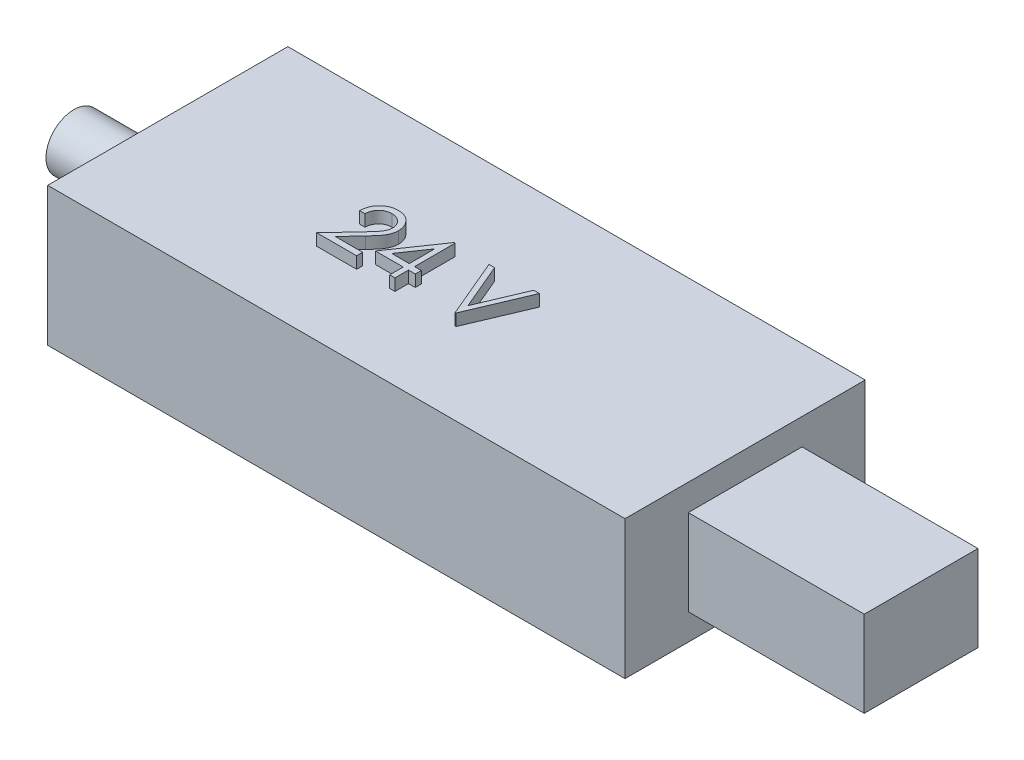
from build123d import *

# Parameters (mm, degrees)
SKETCH1_W           = 125
SKETCH1_H           = 52
BOSS_EXTRUDE1_DEPTH = 30
SKETCH2_W           = 24.62687601
SKETCH2_H           = 18.598470566
BOSS_EXTRUDE2_DEPTH = 38.1
SKETCH3_R           = 6.039414619
BOSS_EXTRUDE3_DEPTH = 20.32
BOSS_EXTRUDE4_DEPTH = 2.54


with BuildPart() as part:
    # Sketch1 → Boss-Extrude1 (new body)
    with BuildSketch(Plane(origin=(0, 0, 0), x_dir=(1, 0, 0), z_dir=(0, 1, 0))):
        Rectangle(SKETCH1_W, SKETCH1_H)
    extrude(amount=BOSS_EXTRUDE1_DEPTH)

    # Sketch2 → Boss-Extrude2 (add)
    with BuildSketch(Plane(origin=(62.5, 0, 0), x_dir=(0, 0, -1), z_dir=(1, 0, 0))):
        with Locations((0, 15)):
            Rectangle(SKETCH2_W, SKETCH2_H)
    extrude(amount=BOSS_EXTRUDE2_DEPTH)

    # Sketch3 → Boss-Extrude3 (add)
    with BuildSketch(Plane.ZY.offset(62.5)):
        with Locations((0, 15)):
            Circle(SKETCH3_R)
    extrude(amount=BOSS_EXTRUDE3_DEPTH)

    # Sketch4 → Boss-Extrude4 (add)
    # profile 1 of 3: a face of its own
    with BuildSketch(Plane(origin=(0, 30, 0), x_dir=(1, 0, 0), z_dir=(0, 1, 0))):
        with BuildLine():
            Line((-20.314153968, 0.487864775), (-21.453897558, 0.487864775))
            add(Edge.make_bspline(
                [(-21.453897558, 0.487864775), (-21.446469317, 0.639070568), (-21.431880449, 0.936034721), (-21.363560657, 1.369010039), (-21.26580376, 1.782866023), (-21.127586198, 2.17427971), (-20.95593199, 2.546711954), (-20.750083034, 2.898683439), (-20.506265347, 3.228851467), (-20.22974377, 3.53415527), (-19.929411851, 3.814235884), (-19.60535887, 4.056099193), (-19.264835486, 4.260451887), (-18.908874809, 4.431289536), (-18.533460764, 4.559522691), (-18.142000109, 4.654669783), (-17.732772957, 4.71191538), (-17.453953448, 4.71806866), (-17.312150763, 4.721198109)],
                knots=[0, 0, 0, 0, 1.10065271, 2.161652631, 3.183658789, 4.190468796, 5.17591951, 6.163126047, 7.15150782, 8.156236427, 9.156009102, 10.134482811, 11.092018607, 12.041330605, 13.001268258, 13.972401359, 14.968799086, 16, 16, 16, 16], degree=3))
            add(Edge.make_bspline(
                [(-17.312150763, 4.721198109), (-17.17289318, 4.717937995), (-16.899257003, 4.711531989), (-16.499889122, 4.656519111), (-16.119697225, 4.570356536), (-15.759424473, 4.449469168), (-15.421945324, 4.286965675), (-15.104724562, 4.091757463), (-14.80398562, 3.865988361), (-14.533269577, 3.600181666), (-14.284683118, 3.316418728), (-14.070226364, 3.013476906), (-13.886572885, 2.700587784), (-13.733491875, 2.375365452), (-13.620802456, 2.034747721), (-13.535247244, 1.683693585), (-13.486887772, 1.318569271), (-13.479465807, 1.071439769), (-13.47569243, 0.945797468)],
                knots=[0, 0, 0, 0, 1.111607364, 2.184268762, 3.212621178, 4.221274766, 5.211760367, 6.196651075, 7.1921475, 8.207485113, 9.220403448, 10.201281604, 11.166441695, 12.114753415, 13.065576456, 14.026450734, 14.996634279, 16, 16, 16, 16], degree=3))
            add(Edge.make_bspline(
                [(-13.47569243, 0.945797468), (-13.481836555, 0.768912468), (-13.494016985, 0.41824655), (-13.598209151, -0.097064524), (-13.76093792, -0.596332073), (-13.956871186, -0.998150283), (-14.15452834, -1.321940389), (-14.332645868, -1.588526833), (-14.541161039, -1.875566675), (-14.783108732, -2.182098728), (-15.053484011, -2.510524012), (-15.354735861, -2.860644127), (-15.689012495, -3.228841692), (-15.923630484, -3.480322017), (-16.045203648, -3.610632821)],
                knots=[0, 0, 0, 0, 1.184426356, 2.348067706, 3.509069118, 4.696110526, 5.333549288, 6.050745305, 6.844228056, 7.710549037, 8.667450064, 9.695053472, 10.805634456, 12, 12, 12, 12], degree=3))
            Line((-16.045203648, -3.610632821), (-19.222747718, -7.001878814))
            Line((-19.222747718, -7.001878814), (-13.312871917, -7.001878814))
            Line((-13.312871917, -7.001878814), (-13.312871917, -8.304442917))
            Line((-13.312871917, -8.304442917), (-21.942359096, -8.304442917))
            Line((-21.942359096, -8.304442917), (-17.017038583, -3.048393237))
            add(Edge.make_bspline(
                [(-17.017038583, -3.048393237), (-16.897121966, -2.923213668), (-16.666786684, -2.682769334), (-16.341004191, -2.331730593), (-16.048399862, -2.006067973), (-15.787079609, -1.706396783), (-15.562712318, -1.428333666), (-15.363604505, -1.180884313), (-15.204072217, -0.953175307), (-15.030933496, -0.689230794), (-14.863242763, -0.366968957), (-14.719143643, 0.026853286), (-14.631278336, 0.432263603), (-14.620737932, 0.706228138), (-14.615436019, 0.844034647)],
                knots=[0, 0, 0, 0, 1.329631726, 2.553950428, 3.673215718, 4.687767853, 5.603093632, 6.413772471, 7.123043292, 7.734684054, 8.834405432, 9.900288307, 10.943827018, 12, 12, 12, 12], degree=3))
            add(Edge.make_bspline(
                [(-14.615436019, 0.844034647), (-14.617742856, 0.930690007), (-14.622289187, 1.101471081), (-14.662412832, 1.351863407), (-14.723048097, 1.593398589), (-14.809935176, 1.826819578), (-14.92462249, 2.049779515), (-15.064225898, 2.262549801), (-15.225298413, 2.46824976), (-15.411630162, 2.661120299), (-15.616323391, 2.83776353), (-15.832565383, 2.994242354), (-16.061347189, 3.125012842), (-16.301704204, 3.232213532), (-16.552966336, 3.316307058), (-16.815619554, 3.37457676), (-17.088938127, 3.411161774), (-17.27556824, 3.416111769), (-17.370664385, 3.418634006)],
                knots=[0, 0, 0, 0, 0.991446411, 1.95395049, 2.89581595, 3.838931463, 4.798493298, 5.75982156, 6.748411868, 7.785213223, 8.824556874, 9.840280684, 10.836137867, 11.835679398, 12.848801643, 13.863922112, 14.911575587, 16, 16, 16, 16], degree=3))
            add(Edge.make_bspline(
                [(-17.370664385, 3.418634006), (-17.469981406, 3.416039461), (-17.665023638, 3.410944201), (-17.951386986, 3.375301963), (-18.224566808, 3.313812771), (-18.485250284, 3.229714553), (-18.733878496, 3.122822104), (-18.969242313, 2.989683488), (-19.190813368, 2.830811955), (-19.399008181, 2.650687651), (-19.590828905, 2.450145212), (-19.759364712, 2.226589061), (-19.906626706, 1.984101011), (-20.035111639, 1.723335356), (-20.139453714, 1.441925925), (-20.21918486, 1.140871682), (-20.282274275, 0.821479812), (-20.303350907, 0.60091679), (-20.314153968, 0.487864775)],
                knots=[0, 0, 0, 0, 1.031018746, 2.02475058, 2.990194455, 3.934040569, 4.864654155, 5.795059489, 6.735614925, 7.690564532, 8.649604399, 9.611025574, 10.590972636, 11.591080095, 12.624614302, 13.701020113, 14.821632451, 16, 16, 16, 16], degree=3))
        make_face()
    # profile 2 of 3: a face of its own
    with BuildSketch(Plane(origin=(0, 30, 0), x_dir=(1, 0, 0), z_dir=(0, 1, 0))):
        Polygon((-5.24053618, 4.721198109), (-5.009025763, 4.721198109), (-5.009025763, -4.071109584), (-3.543641148, -4.071109584), (-3.543641148, -5.373673686), (-5.009025763, -5.373673686), (-5.009025763, -8.304442917), (-6.148769353, -8.304442917), (-6.148769353, -5.373673686), (-12.173128327, -5.373673686), align=None)
        Polygon((-6.148769353, -4.071109584), (-6.148769353, 1.444435288), (-9.934346276, -4.071109584), align=None, mode=Mode.SUBTRACT)
    # profile 3 of 3: a face of its own
    with BuildSketch(Plane(origin=(0, 30, 0), x_dir=(1, 0, 0), z_dir=(0, 1, 0))):
        Polygon((2.64353834, 4.395557083), (3.864692186, 4.395557083), (8.098025519, -5.612816314), (12.331358852, 4.395557083), (13.552512699, 4.395557083), (8.179435776, -8.304442917), (8.016615263, -8.304442917), align=None)
    extrude(amount=BOSS_EXTRUDE4_DEPTH)


solid = part.part
